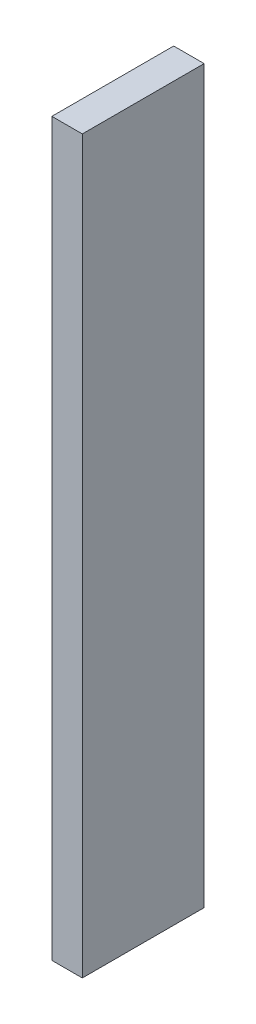
from build123d import *

# Parameters (mm, degrees)
SKETCH1_W           = 3.175
SKETCH1_H           = 12.7
BOSS_EXTRUDE1_DEPTH = 76.2


with BuildPart() as part:
    # Sketch1 → Boss-Extrude1 (new body)
    with BuildSketch(Plane(origin=(0, 0, 0), x_dir=(1, 0, 0), z_dir=(0, 1, 0))):
        with Locations((1.5875, 6.35)):
            Rectangle(SKETCH1_W, SKETCH1_H)
    extrude(amount=BOSS_EXTRUDE1_DEPTH)


solid = part.part
